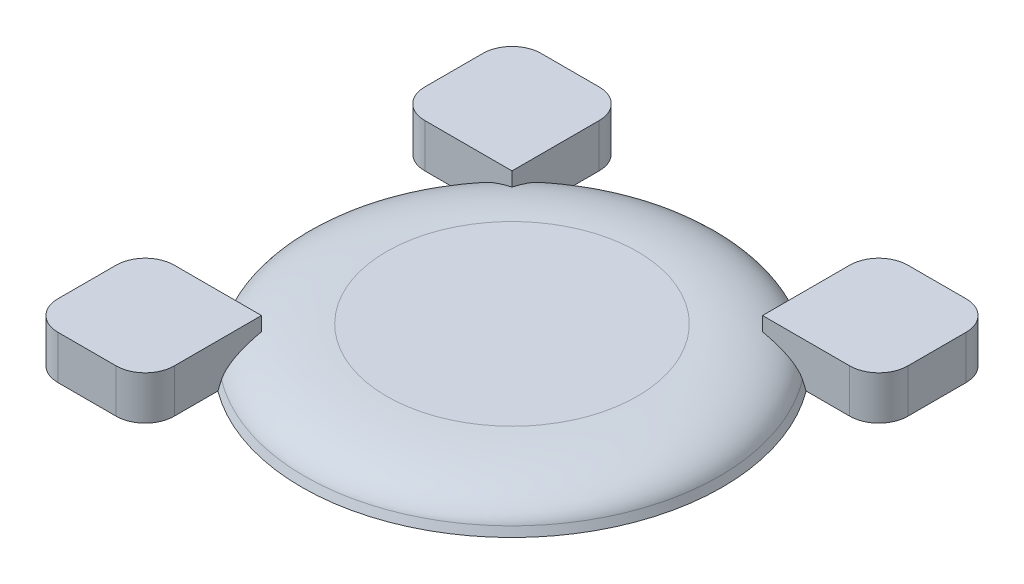
from build123d import *

# Parameters (mm, degrees)
SKETCH2_R                = 14.463803576
BOSS_EXTRUDE1_DEPTH      = 2.5
BOSS_EXTRUDE1_TAPER      = 20
SKETCH4_W                = 8
SKETCH4_H                = 8
BOSS_EXTRUDE2_DEPTH      = 3
FILLET2_R                = 2
CIRPATTERN1_COUNT        = 4
FILLET2_OF_CIRPATTERN1_R = 2


with BuildPart() as part:
    # Sketch2 → Boss-Extrude1 (new body)
    with BuildSketch(Plane(origin=(0, 0, 0), x_dir=(1, 0, 0), z_dir=(0, 1, 0))):
        Circle(SKETCH2_R)
    extrude(amount=BOSS_EXTRUDE1_DEPTH, taper=BOSS_EXTRUDE1_TAPER)

    # Fillet1
    # an asymmetric fillet: 6, 4 mm, written as the material it takes off along each edge
    with BuildSketch(Plane(origin=(0, 2.5, 0), x_dir=(1, 0, 0), z_dir=(0, 0, -1))) as fillet1_piece_1:
        with BuildLine():
            Bezier((14.262848017, 1.94787914), (13.55387799, 0), (8.624692292, 0), weights=[1, 0.819152044, 1])
            Line((8.624692292, 0), (13.55387799, 0))
            Line((13.55387799, 0), (14.262848017, 1.94787914))
        make_face()
    revolve(axis=Axis((0, 2.5, 0), (0, -1, 0)), mode=Mode.SUBTRACT)

    # Sketch4 → Boss-Extrude2 (add)
    with BuildSketch(Plane(origin=(0, 0, 0), x_dir=(1, 0, 0), z_dir=(0, 1, 0))):
        with Locations((-12.616427752, -12.616427752)):
            Rectangle(SKETCH4_W, SKETCH4_H)
    boss_extrude2 = extrude(amount=BOSS_EXTRUDE2_DEPTH)

    # Fillet2
    fillet2_edges = [part.edges().sort_by_distance(p)[0] for p in [
        (-8.616427752, 1.5, 16.616427752),
        (-16.616427752, 1.5, 8.616427752),
        (-16.616427752, 1.5, 16.616427752),
    ]]
    fillet(fillet2_edges, radius=FILLET2_R)

    # CirPattern1: Boss-Extrude2 ×4 about axis, 1 skipped
    cirpattern1_axis = Axis((0, 0, 0), (0, 1, 0))
    add([boss_extrude2.rotate(cirpattern1_axis, i * 360 / CIRPATTERN1_COUNT) for i in range(1, CIRPATTERN1_COUNT) if i not in (1,)])

    # Fillet2 of CirPattern1
    fillet2_of_cirpattern1_edges = [part.edges().sort_by_distance(p)[0] for p in [
        (8.616427752, 1.5, -16.616427752),
        (16.616427752, 1.5, -8.616427752),
        (16.616427752, 1.5, -16.616427752),
        (-16.616427752, 1.5, -8.616427752),
        (-8.616427752, 1.5, -16.616427752),
        (-16.616427752, 1.5, -16.616427752),
    ]]
    fillet(fillet2_of_cirpattern1_edges, radius=FILLET2_OF_CIRPATTERN1_R)


solid = part.part
